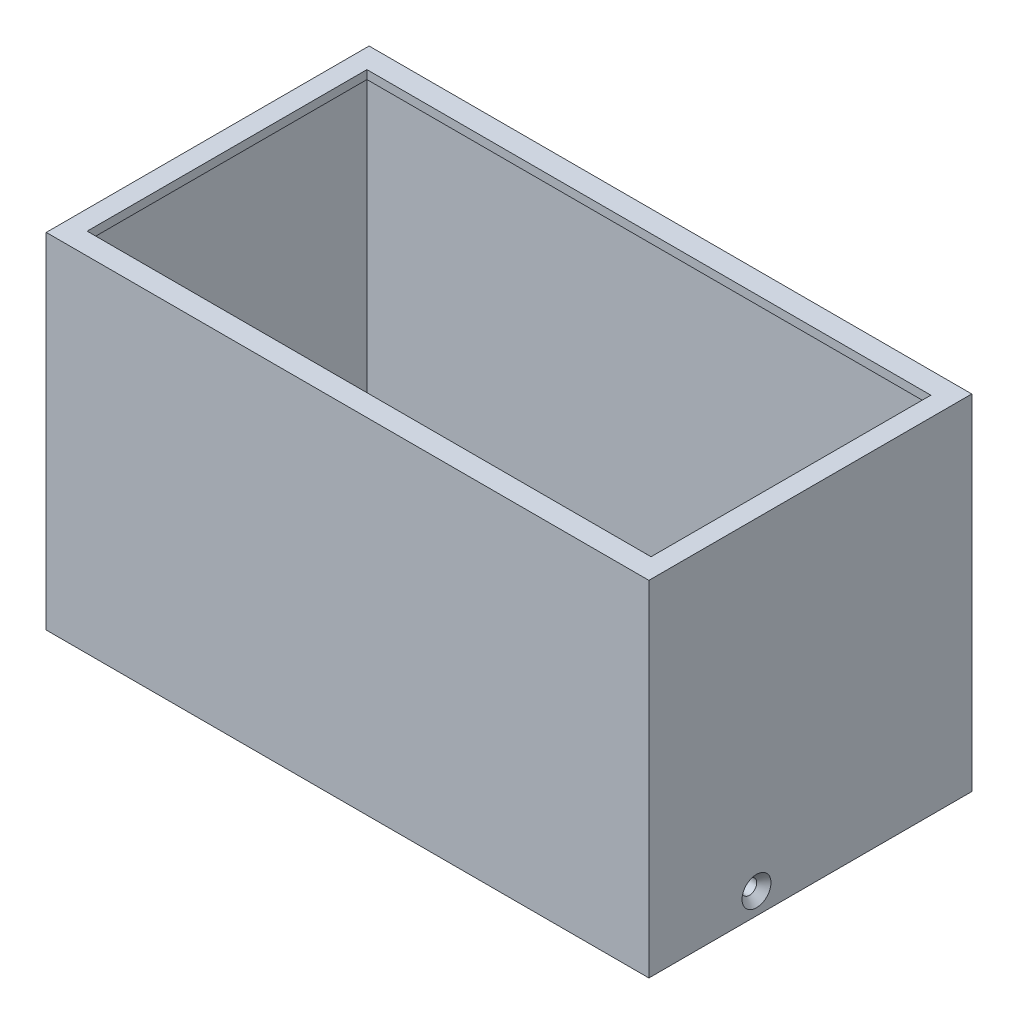
from build123d import *

# Parameters (mm, degrees)
SKETCH_1_W                   = 140
SKETCH_1_H                   = 75
EXTRUDE_1_DEPTH              = 80
SKETCH_2_W                   = 131
SKETCH_2_H                   = 65
CUT_EXTRUDE_1_DEPTH          = 2
SKETCH_3_W                   = 132
SKETCH_3_H                   = 66
CUT_EXTRUDE_2_DEPTH          = 78
CUT_EXTRUDE_3_DEPTH          = 10
HOLE_WIZARD_M3_3_D           = 3.4
HOLE_WIZARD_M3_3_DEPTH       = 6
HOLE_WIZARD_M3_3_CSINK_D     = 6.72
HOLE_WIZARD_M3_3_CSINK_ANGLE = 90
HOLE_WIZARD_M3_3_TIP         = 1.021463052
HOLE_WIZARD_M3_4_D           = 3.4
HOLE_WIZARD_M3_4_DEPTH       = 6
HOLE_WIZARD_M3_4_CSINK_D     = 6.72
HOLE_WIZARD_M3_4_CSINK_ANGLE = 90
HOLE_WIZARD_M3_4_TIP         = 1.021463052
HOLE_WIZARD_M3_5_D           = 3.4
HOLE_WIZARD_M3_5_DEPTH       = 6
HOLE_WIZARD_M3_5_CSINK_D     = 6.72
HOLE_WIZARD_M3_5_CSINK_ANGLE = 90
HOLE_WIZARD_M3_5_TIP         = 1.021463052


with BuildPart() as part:
    # 草图1 → 凸台-拉伸1 (new body)
    with BuildSketch(Plane(origin=(0, 0, 0), x_dir=(1, 0, 0), z_dir=(0, 1, 0))):
        Rectangle(SKETCH_1_W, SKETCH_1_H)
    extrude(amount=EXTRUDE_1_DEPTH)

    # 草图2 → 切除-拉伸1 (cut)
    with BuildSketch(Plane(origin=(0, 80, 0), x_dir=(1, 0, 0), z_dir=(0, 1, 0))):
        Rectangle(SKETCH_2_W, SKETCH_2_H)
    extrude(amount=-CUT_EXTRUDE_1_DEPTH, mode=Mode.SUBTRACT)

    # 草图3 → 切除-拉伸2 (cut)
    with BuildSketch(Plane.XZ):
        Rectangle(SKETCH_3_W, SKETCH_3_H)
    extrude(amount=-CUT_EXTRUDE_2_DEPTH, mode=Mode.SUBTRACT)

    # 草图4 → 切除-拉伸3 (cut)
    with BuildSketch(Plane.ZY.offset(70)):
        with BuildLine():
            Line((25.5, 36), (25.5, 44))
            ThreePointArc((25.5, 44), (28, 46.5), (30.5, 44))
            Line((30.5, 44), (30.5, 36))
            ThreePointArc((30.5, 36), (28, 33.5), (25.5, 36))
        make_face()
    extrude(amount=-CUT_EXTRUDE_3_DEPTH, mode=Mode.SUBTRACT)

    # M3 六角凹锥坑螺钉的锥形沉头孔3
    with Locations(Plane(origin=(-70, 5, -2.5), x_dir=(0, 0, -1), z_dir=(-1, 0, 0))):
        with Locations((0, 0)):
            CounterSinkHole(HOLE_WIZARD_M3_3_D / 2, HOLE_WIZARD_M3_3_CSINK_D / 2, depth=HOLE_WIZARD_M3_3_DEPTH, counter_sink_angle=HOLE_WIZARD_M3_3_CSINK_ANGLE)
            with Locations((0, 0, -(HOLE_WIZARD_M3_3_DEPTH + HOLE_WIZARD_M3_3_TIP / 2))):  # 118° drill point
                Cone(0, HOLE_WIZARD_M3_3_D / 2, HOLE_WIZARD_M3_3_TIP, mode=Mode.SUBTRACT)

    # M3 六角凹锥坑螺钉的锥形沉头孔4
    with Locations(Plane(origin=(70, 5, 12.5), x_dir=(0, 0, 1), z_dir=(1, 0, 0))):
        with Locations((0, 0)):
            CounterSinkHole(HOLE_WIZARD_M3_4_D / 2, HOLE_WIZARD_M3_4_CSINK_D / 2, depth=HOLE_WIZARD_M3_4_DEPTH, counter_sink_angle=HOLE_WIZARD_M3_4_CSINK_ANGLE)
            with Locations((0, 0, -(HOLE_WIZARD_M3_4_DEPTH + HOLE_WIZARD_M3_4_TIP / 2))):  # 118° drill point
                Cone(0, HOLE_WIZARD_M3_4_D / 2, HOLE_WIZARD_M3_4_TIP, mode=Mode.SUBTRACT)

    # M3 六角凹锥坑螺钉的锥形沉头孔5
    with Locations(Plane(origin=(-15, 5, -37.5), x_dir=(-1, 0, 0), z_dir=(0, 0, -1))):
        with Locations((0, 0)):
            CounterSinkHole(HOLE_WIZARD_M3_5_D / 2, HOLE_WIZARD_M3_5_CSINK_D / 2, depth=HOLE_WIZARD_M3_5_DEPTH, counter_sink_angle=HOLE_WIZARD_M3_5_CSINK_ANGLE)
            with Locations((0, 0, -(HOLE_WIZARD_M3_5_DEPTH + HOLE_WIZARD_M3_5_TIP / 2))):  # 118° drill point
                Cone(0, HOLE_WIZARD_M3_5_D / 2, HOLE_WIZARD_M3_5_TIP, mode=Mode.SUBTRACT)


solid = part.part
